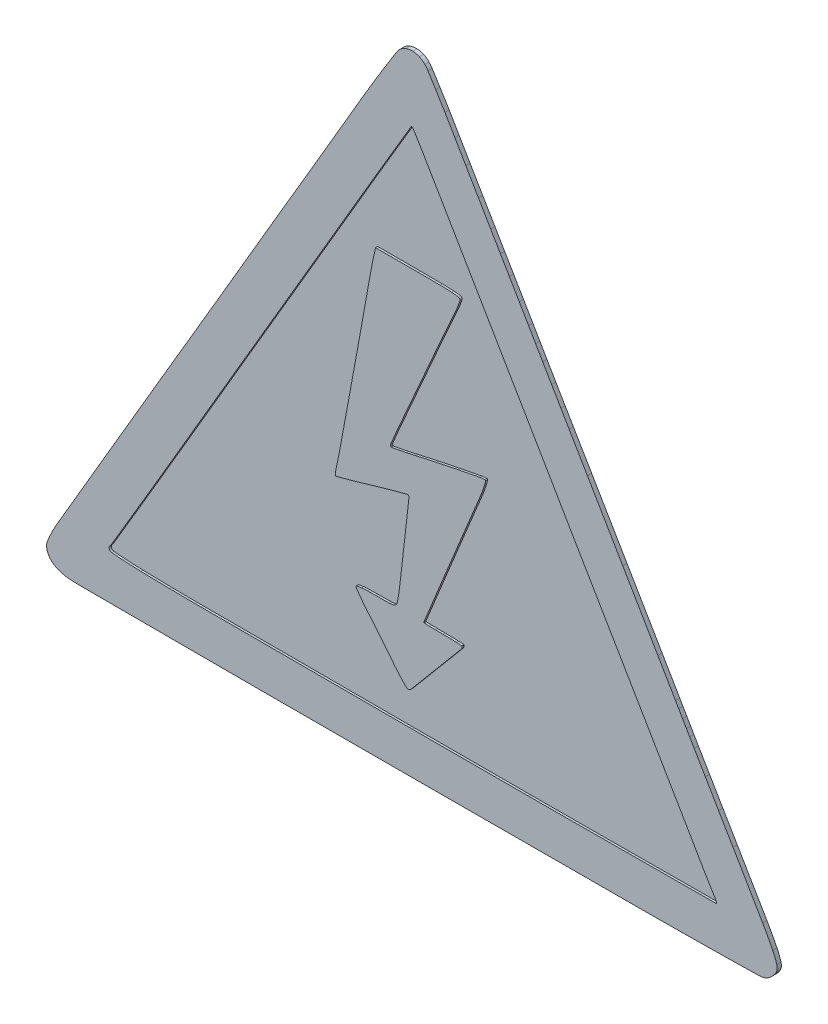
from build123d import *

# Parameters (mm, degrees)
SALIENTE_EXTRUIR1_DEPTH   = 2
SALIENTE_EXTRUIR1_2_DEPTH = 2
SALIENTE_EXTRUIR2_DEPTH   = 1


with BuildPart() as part:
    # Model → Saliente-Extruir1 (new body)
    with BuildSketch(Plane.XY):
        with BuildLine():
            ThreePointArc((416.430197, 527.849842), (412.923750156, 521.934018563), (409.448184, 516))
            Line((409.448184, 516), (401.939084, 503.113004))
            Line((401.939084, 503.113004), (394.060376, 489.6125))
            Line((394.060376, 489.6125), (386.92117, 477.396705))
            Line((386.92117, 477.396705), (382, 469))
            Line((382, 469), (377.075849, 460.603484))
            Line((377.075849, 460.603484), (369.926018, 448.3875))
            Line((369.926018, 448.3875), (362.032334, 434.886999))
            Line((362.032334, 434.886999), (354.505499, 422))
            Line((354.505499, 422), (347.08452, 409.296129))
            Line((347.08452, 409.296129), (339.509516, 396.346875))
            Line((339.509516, 396.346875), (332.792163, 384.879413))
            Line((332.792163, 384.879413), (328.456227, 377.5))
            Line((328.456227, 377.5), (323.875911, 369.702996))
            Line((323.875911, 369.702996), (315.943002, 356.15625))
            Line((315.943002, 356.15625), (306.760551, 340.457838))
            Line((306.760551, 340.457838), (297.43696, 324.5))
            Line((297.43696, 324.5), (288.290074, 308.838862))
            Line((288.290074, 308.838862), (279.640018, 294.034475))
            Line((279.640018, 294.034475), (272.335658, 281.538426))
            Line((272.335658, 281.538426), (268.831652, 275.553532))
            ThreePointArc((268.831652, 275.553532), (267.643279765, 273.477287903), (266.498497, 271.376695))
            ThreePointArc((266.498497, 271.376695), (265.537732428, 269.500739616), (264.634538, 267.596398))
            ThreePointArc((264.634538, 267.596398), (263.952827427, 266.03979721), (263.317632, 264.463643))
            ThreePointArc((263.317632, 264.463643), (263.080084515, 263.62552237), (263, 262.758077))
            ThreePointArc((263, 262.758077), (263.178190186, 261.213999553), (263.703395, 259.751096))
            ThreePointArc((263.703395, 259.751096), (264.557685736, 258.408881349), (265.678065, 257.279234))
            ThreePointArc((265.678065, 257.279234), (267.19880015, 256.251542805), (268.875977, 255.505981))
            ThreePointArc((268.875977, 255.505981), (270.970220708, 254.910091879), (273.115825, 254.539521))
            ThreePointArc((273.115825, 254.539521), (275.235339101, 254.350221442), (277.362243, 254.283482))
            Line((277.362243, 254.283482), (324.225128, 254.17688))
            ThreePointArc((324.225128, 254.17688), (350.823582643, 254.138627215), (377.422064, 254.132133))
            Line((377.422064, 254.132133), (439.544184, 254.200801))
            Line((439.544184, 254.200801), (540.663889, 254.427492))
            ThreePointArc((540.663889, 254.427492), (559.288658378, 254.523919526), (577.912693, 254.715406))
            ThreePointArc((577.912693, 254.715406), (588.698628999, 254.881591571), (599.483567, 255.103279))
            ThreePointArc((599.483567, 255.103279), (601.495703142, 255.432876077), (603.339721, 256.30289))
            ThreePointArc((603.339721, 256.30289), (603.924221205, 256.717807899), (604.476223, 257.175073))
            ThreePointArc((604.476223, 257.175073), (605.061059424, 257.725991376), (605.615898, 258.30711))
            ThreePointArc((605.615898, 258.30711), (606.120687471, 258.895725518), (606.593106, 259.510625))
            ThreePointArc((606.593106, 259.510625), (606.93615701, 260.036477724), (607.224806, 260.59405))
            ThreePointArc((607.224806, 260.59405), (607.62336217, 262.155539029), (607.45392, 263.758157))
            ThreePointArc((607.45392, 263.758157), (606.607518538, 266.24276379), (605.539456, 268.640452))
            ThreePointArc((605.539456, 268.640452), (603.233329183, 273.070112196), (600.790475, 277.425864))
            ThreePointArc((600.790475, 277.425864), (593.807815162, 289.403731538), (586.798486, 301.366012))
            Line((586.798486, 301.366012), (580.00006, 312.943251))
            Line((580.00006, 312.943251), (573.729503, 323.630954))
            Line((573.729503, 323.630954), (568.474019, 332.596389))
            Line((568.474019, 332.596389), (566.341853, 336.25))
            Line((566.341853, 336.25), (564.820585, 338.867571))
            Line((564.820585, 338.867571), (563.000175, 342))
            Line((563.000175, 342), (561.179825, 345.13243))
            Line((561.179825, 345.13243), (559.658743, 347.75))
            Line((559.658743, 347.75), (551.354162, 361.999301))
            Line((551.354162, 361.999301), (534.742248, 390.405982))
            Line((534.742248, 390.405982), (518.121933, 418.801272))
            Line((518.121933, 418.801272), (509.4906, 433.5))
            Line((509.4906, 433.5), (505.601969, 440.11849))
            Line((505.601969, 440.11849), (501.211805, 447.61875))
            Line((501.211805, 447.61875), (497.000478, 454.835745))
            Line((497.000478, 454.835745), (493.710846, 460.5))
            Line((493.710846, 460.5), (490.364183, 466.261325))
            Line((490.364183, 466.261325), (485.950822, 473.821875))
            Line((485.950822, 473.821875), (481.276478, 481.805429))
            Line((481.276478, 481.805429), (477.049172, 489))
            Line((477.049172, 489), (472.488256, 496.76225))
            Line((472.488256, 496.76225), (466.729954, 506.592119))
            Line((466.729954, 506.592119), (460.777387, 516.774124))
            Line((460.777387, 516.774124), (455.561736, 525.717853))
            ThreePointArc((455.561736, 525.717853), (453.233314345, 529.689247458), (450.881241, 533.64668))
            ThreePointArc((450.881241, 533.64668), (448.733927828, 537.202372853), (446.557842, 540.74053))
            ThreePointArc((446.557842, 540.74053), (444.713362388, 543.694505499), (442.85287, 546.638422))
            ThreePointArc((442.85287, 546.638422), (442.188981271, 547.585091725), (441.442212, 548.467853))
            ThreePointArc((441.442212, 548.467853), (440.237689815, 549.527837311), (438.843834, 550.322574))
            ThreePointArc((438.843834, 550.322574), (437.301331377, 550.830894994), (435.689316, 551.02866))
            ThreePointArc((435.689316, 551.02866), (434.048835522, 550.909331853), (432.461745, 550.477407))
            ThreePointArc((432.461745, 550.477407), (430.977837148, 549.747257215), (429.658527, 548.75))
            ThreePointArc((429.658527, 548.75), (428.83724314, 547.888500965), (428.138478, 546.924958))
            ThreePointArc((428.138478, 546.924958), (425.415994455, 542.568352529), (422.709876, 538.201563))
            ThreePointArc((422.709876, 538.201563), (419.55030612, 533.037671568), (416.430197, 527.849842))
        make_face()
        with BuildLine():
            ThreePointArc((438.198212, 515.837765), (438.975290904, 514.546421242), (439.743869, 513.25))
            Line((439.743869, 513.25), (448.211646, 498.812694))
            Line((448.211646, 498.812694), (474.061677, 454.588307))
            Line((474.061677, 454.588307), (501.778861, 407.157611))
            ThreePointArc((501.778861, 407.157611), (503.275383054, 404.582380815), (504.759532, 402))
            ThreePointArc((504.759532, 402), (505.503340462, 400.706072656), (506.253586, 399.415867))
            Line((506.253586, 399.415867), (514.178055, 385.86875))
            Line((514.178055, 385.86875), (523.424765, 370.072826))
            Line((523.424765, 370.072826), (534.013553, 352))
            Line((534.013553, 352), (544.998385, 333.243829))
            Line((544.998385, 333.243829), (555.46692, 315.340625))
            Line((555.46692, 315.340625), (564.329822, 300.158748))
            Line((564.329822, 300.158748), (568.775213, 292.5))
            Line((568.775213, 292.5), (571.749978, 287.376922))
            Line((571.749978, 287.376922), (574.476773, 282.739326))
            Line((574.476773, 282.739326), (576.784025, 278.862394))
            ThreePointArc((576.784025, 278.862394), (577.202127118, 278.188075149), (577.641613, 277.527494))
            ThreePointArc((577.641613, 277.527494), (577.908440496, 277.125760299), (578.161632, 276.715296))
            ThreePointArc((578.161632, 276.715296), (578.389105211, 276.314894696), (578.600974, 275.906022))
            ThreePointArc((578.600974, 275.906022), (578.766276036, 275.554953185), (578.918305, 275.197936))
            ThreePointArc((578.918305, 275.197936), (578.979386902, 274.991646694), (579, 274.777494))
            ThreePointArc((579, 274.777494), (578.90689246, 274.551829861), (578.681747, 274.457475))
            Line((578.681747, 274.457475), (536.846875, 274.228389))
            ThreePointArc((536.846875, 274.228389), (513.686106062, 274.122512267), (490.525191, 274.05587))
            Line((490.525191, 274.05587), (435.5, 274))
            Line((435.5, 274), (336.363765, 274.053289))
            ThreePointArc((336.363765, 274.053289), (321.94037209, 274.154672757), (307.519209, 274.427797))
            ThreePointArc((307.519209, 274.427797), (300.635073768, 274.718936011), (293.765211, 275.249092))
            ThreePointArc((293.765211, 275.249092), (292.615179288, 276.130562927), (292.906319, 277.55))
            ThreePointArc((292.906319, 277.55), (293.246064807, 277.949544722), (293.537995, 278.385251))
            Line((293.537995, 278.385251), (303.751815, 295.699063))
            Line((303.751815, 295.699063), (315.169722, 315.120233))
            Line((315.169722, 315.120233), (328.554452, 338))
            Line((328.554452, 338), (342.204744, 361.374872))
            Line((342.204744, 361.374872), (354.470266, 382.371875))
            Line((354.470266, 382.371875), (364.789156, 400.031274))
            Line((364.789156, 400.031274), (367.992123, 405.5))
            Line((367.992123, 405.5), (370.719672, 410.154068))
            Line((370.719672, 410.154068), (375.941876, 419.08125))
            Line((375.941876, 419.08125), (382.077848, 429.576308))
            Line((382.077848, 429.576308), (388.460929, 440.5))
            Line((388.460929, 440.5), (415.414724, 486.612303))
            ThreePointArc((415.414724, 486.612303), (421.308011551, 496.661873977), (427.224538, 506.697781))
            Line((427.224538, 506.697781), (434.914392, 519.692959))
            ThreePointArc((434.914392, 519.692959), (435.143099204, 519.917851453), (435.453156, 520))
            ThreePointArc((435.453156, 520), (435.561882693, 519.972256917), (435.644024, 519.895811))
            Line((435.644024, 519.895811), (436.845104, 518.017187))
            ThreePointArc((436.845104, 518.017187), (437.527442186, 516.931067149), (438.198212, 515.837765))
        make_face(mode=Mode.SUBTRACT)
    extrude(amount=SALIENTE_EXTRUIR1_DEPTH)



with BuildPart() as body_2:
    # Model → Saliente-Extruir1 2 (new body)
    with BuildSketch(Plane.XY):
        with BuildLine():
            ThreePointArc((417.111387, 457.083778), (416.835348844, 455.763698724), (416.572853, 454.44086))
            Line((416.572853, 454.44086), (415.761166, 450.176778))
            Line((415.761166, 450.176778), (414.862085, 445.311607))
            Line((414.862085, 445.311607), (413.995454, 440.474214))
            ThreePointArc((413.995454, 440.474214), (412.285646525, 430.852649106), (410.549694, 421.235767))
            Line((410.549694, 421.235767), (405.886688, 395.775266))
            Line((405.886688, 395.775266), (401.130965, 370.055395))
            ThreePointArc((401.130965, 370.055395), (400.557010462, 367.112704391), (399.928549, 364.181171))
            ThreePointArc((399.928549, 364.181171), (399.742691095, 363.318344407), (399.571179, 362.452552))
            ThreePointArc((399.571179, 362.452552), (399.438165924, 361.698468928), (399.324307, 360.941257))
            ThreePointArc((399.324307, 360.941257), (399.242512567, 360.312491814), (399.169798, 359.682612))
            ThreePointArc((399.169798, 359.682612), (399.187777746, 359.527719113), (399.270887, 359.39578))
            ThreePointArc((399.270887, 359.39578), (399.41835356, 359.310716487), (399.588595, 359.310915))
            Line((399.588595, 359.310915), (404.451679, 360.62853))
            ThreePointArc((404.451679, 360.62853), (407.20758003, 361.389772731), (409.95781, 362.171256))
            ThreePointArc((409.95781, 362.171256), (413.196946145, 363.112442215), (416.431818, 364.068182))
            ThreePointArc((416.431818, 364.068182), (419.66959183, 365.022416598), (422.912885, 365.95772))
            ThreePointArc((422.912885, 365.95772), (425.673701236, 366.731009456), (428.441733, 367.478059))
            Line((428.441733, 367.478059), (433.285902, 368.750144))
            ThreePointArc((433.285902, 368.750144), (433.504763642, 368.748987013), (433.694113, 368.639221))
            ThreePointArc((433.694113, 368.639221), (433.908825356, 368.297533737), (433.954049, 367.896527))
            Line((433.954049, 367.896527), (431.599928, 347.041173))
            ThreePointArc((431.599928, 347.041173), (430.515929619, 337.56921503), (429.409107, 328.099897))
            ThreePointArc((429.409107, 328.099897), (428.993203258, 325.163750577), (428.441851, 322.25))
            ThreePointArc((428.441851, 322.25), (428.205515624, 321.579572311), (427.80624, 320.991434))
            ThreePointArc((427.80624, 320.991434), (427.292626782, 320.56773188), (426.673813, 320.321985))
            ThreePointArc((426.673813, 320.321985), (425.550321029, 320.128134583), (424.412884, 320.050358))
            ThreePointArc((424.412884, 320.050358), (421.447022885, 320.012588466), (418.480948, 320))
            ThreePointArc((418.480948, 320), (416.541660986, 319.983478827), (414.602937, 319.933917))
            ThreePointArc((414.602937, 319.933917), (413.100090964, 319.855634158), (411.601027, 319.723416))
            ThreePointArc((411.601027, 319.723416), (410.481029693, 319.588340741), (409.365281, 319.421775))
            ThreePointArc((409.365281, 319.421775), (409.103649961, 319.273912156), (409, 318.991829))
            ThreePointArc((409, 318.991829), (409.051526266, 318.65534351), (409.201383, 318.349696))
            ThreePointArc((409.201383, 318.349696), (409.93927043, 317.301780383), (410.689062, 316.262349))
            ThreePointArc((410.689062, 316.262349), (411.605879437, 315.032215747), (412.546806, 313.820424))
            ThreePointArc((412.546806, 313.820424), (413.639298939, 312.460652049), (414.75, 311.115712))
            ThreePointArc((414.75, 311.115712), (416.070731708, 309.53068975), (417.384047, 307.939517))
            Line((417.384047, 307.939517), (420.573438, 304.036412))
            Line((420.573438, 304.036412), (423.785403, 300.064057))
            ThreePointArc((423.785403, 300.064057), (425.146226073, 298.364997965), (426.5, 296.660317))
            ThreePointArc((426.5, 296.660317), (427.676934656, 295.202256541), (428.882841, 293.768065))
            ThreePointArc((428.882841, 293.768065), (429.961156965, 292.549509992), (431.076143, 291.364416))
            ThreePointArc((431.076143, 291.364416), (432.012158042, 290.418217889), (432.96655, 289.490559))
            ThreePointArc((432.96655, 289.490559), (433.285129599, 289.305926619), (433.652828, 289.286434))
            ThreePointArc((433.652828, 289.286434), (434.362272596, 289.549372897), (434.941715, 290.035886))
            Line((434.941715, 290.035886), (446.733973, 304.052849))
            Line((446.733973, 304.052849), (458.497567, 318.103192))
            ThreePointArc((458.497567, 318.103192), (458.870512504, 318.751695959), (459, 319.488499))
            ThreePointArc((459, 319.488499), (458.944335715, 319.629755877), (458.807271, 319.695065))
            ThreePointArc((458.807271, 319.695065), (457.582002345, 319.776238171), (456.35625, 319.849747))
            ThreePointArc((456.35625, 319.849747), (454.90410457, 319.919367682), (453.450953, 319.96323))
            ThreePointArc((453.450953, 319.96323), (451.725574437, 319.990806613), (450, 320))
            ThreePointArc((450, 320), (448.274457758, 320.004979168), (446.548973, 320.019918))
            ThreePointArc((446.548973, 320.019918), (445.096213607, 320.043677939), (443.64375, 320.081412))
            Line((443.64375, 320.081412), (441.109133, 320.164183))
            ThreePointArc((441.109133, 320.164183), (441.031739695, 320.198612331), (441, 320.277147))
            ThreePointArc((441, 320.277147), (441.026498669, 320.548596205), (441.104994, 320.809796))
            Line((441.104994, 320.809796), (450.391025, 343.446101))
            Line((450.391025, 343.446101), (459.207792, 364.866731))
            ThreePointArc((459.207792, 364.866731), (463.014130712, 374.061745131), (466.836757, 383.25))
            ThreePointArc((466.836757, 383.25), (467.663199658, 385.276995777), (468.457123, 387.316948))
            ThreePointArc((468.457123, 387.316948), (469.001831804, 388.838563951), (469.487142, 390.380153))
            ThreePointArc((469.487142, 390.380153), (469.785615631, 391.473240707), (470.04225, 392.576901))
            ThreePointArc((470.04225, 392.576901), (469.971841688, 392.870161289), (469.699627, 393))
            ThreePointArc((469.699627, 393), (468.482171807, 392.941965518), (467.275757, 392.76839))
            ThreePointArc((467.275757, 392.76839), (462.342530561, 391.809427033), (457.412137, 390.836004))
            ThreePointArc((457.412137, 390.836004), (452.152950421, 389.77217657), (446.900669, 388.674765))
            ThreePointArc((446.900669, 388.674765), (442.00858919, 387.616156144), (437.124992, 386.51908))
            ThreePointArc((437.124992, 386.51908), (434.93249823, 386.026049909), (432.736398, 385.549341))
            ThreePointArc((432.736398, 385.549341), (430.859288766, 385.160879594), (428.977676, 384.794854))
            Line((428.977676, 384.794854), (425.719085, 384.192449))
            ThreePointArc((425.719085, 384.192449), (425.527277279, 384.204311016), (425.362863, 384.303804))
            ThreePointArc((425.362863, 384.303804), (425.199994844, 384.605331082), (425.22911, 384.946794))
            ThreePointArc((425.22911, 384.946794), (425.930311445, 386.700856933), (426.649308, 388.447701))
            ThreePointArc((426.649308, 388.447701), (427.942106016, 391.504602355), (429.262686, 394.549605))
            Line((429.262686, 394.549605), (436.718769, 411.5))
            Line((436.718769, 411.5), (439.84227, 418.59528))
            Line((439.84227, 418.59528), (443.032754, 425.85625))
            Line((443.032754, 425.85625), (445.86206, 432.306843))
            Line((445.86206, 432.306843), (447.693915, 436.5))
            Line((447.693915, 436.5), (449.275419, 440.096855))
            Line((449.275419, 440.096855), (451.156568, 444.310176))
            Line((451.156568, 444.310176), (453.031807, 448.461681))
            Line((453.031807, 448.461681), (454.589033, 451.853792))
            ThreePointArc((454.589033, 451.853792), (455.252031662, 453.308629626), (455.895471, 454.772223))
            ThreePointArc((455.895471, 454.772223), (456.458763622, 456.10995016), (456.998028, 457.457543))
            ThreePointArc((456.998028, 457.457543), (457.429662639, 458.586887112), (457.846269, 459.721861))
            ThreePointArc((457.846269, 459.721861), (457.96127978, 460.156177327), (458, 460.603792))
            ThreePointArc((458, 460.603792), (457.816431466, 461.10298925), (457.35319, 461.364337))
            ThreePointArc((457.35319, 461.364337), (455.772651743, 461.58458086), (454.18371, 461.732475))
            ThreePointArc((454.18371, 461.732475), (451.467689654, 461.881700575), (448.748402, 461.948853))
            ThreePointArc((448.748402, 461.948853), (443.415694325, 461.98721448), (438.082864, 462))
            Line((438.082864, 462), (418.165728, 462))
            Line((418.165728, 462), (417.111387, 457.083778))
        make_face()
    extrude(amount=SALIENTE_EXTRUIR1_2_DEPTH)


with BuildPart() as part_1:
    add(part.part)

    add(body_2.part)  # Saliente-Extruir2 merges body 2
    # Model<3> → Saliente-Extruir2 (add)
    with BuildSketch(Plane.XY):
        with BuildLine():
            Line((448.211646, 498.812694), (439.743869, 513.25))
            ThreePointArc((439.743869, 513.25), (438.975290904, 514.546421242), (438.198212, 515.837765))
            ThreePointArc((438.198212, 515.837765), (437.527442186, 516.931067149), (436.845104, 518.017187))
            Line((436.845104, 518.017187), (435.644024, 519.895811))
            ThreePointArc((435.644024, 519.895811), (435.561882693, 519.972256917), (435.453156, 520))
            ThreePointArc((435.453156, 520), (435.143099204, 519.917851453), (434.914392, 519.692959))
            Line((434.914392, 519.692959), (427.224538, 506.697781))
            ThreePointArc((427.224538, 506.697781), (421.308011551, 496.661873977), (415.414724, 486.612303))
            Line((415.414724, 486.612303), (388.460929, 440.5))
            Line((388.460929, 440.5), (382.077848, 429.576308))
            Line((382.077848, 429.576308), (375.941876, 419.08125))
            Line((375.941876, 419.08125), (370.719672, 410.154068))
            Line((370.719672, 410.154068), (367.992123, 405.5))
            Line((367.992123, 405.5), (364.789156, 400.031274))
            Line((364.789156, 400.031274), (354.470266, 382.371875))
            Line((354.470266, 382.371875), (342.204744, 361.374872))
            Line((342.204744, 361.374872), (328.554452, 338))
            Line((328.554452, 338), (315.169722, 315.120233))
            Line((315.169722, 315.120233), (303.751815, 295.699063))
            Line((303.751815, 295.699063), (293.537995, 278.385251))
            ThreePointArc((293.537995, 278.385251), (293.246064807, 277.949544722), (292.906319, 277.55))
            ThreePointArc((292.906319, 277.55), (292.615179288, 276.130562927), (293.765211, 275.249092))
            ThreePointArc((293.765211, 275.249092), (300.635073768, 274.718936011), (307.519209, 274.427797))
            ThreePointArc((307.519209, 274.427797), (321.94037209, 274.154672757), (336.363765, 274.053289))
            Line((336.363765, 274.053289), (435.5, 274))
            Line((435.5, 274), (490.525191, 274.05587))
            ThreePointArc((490.525191, 274.05587), (513.686106062, 274.122512267), (536.846875, 274.228389))
            Line((536.846875, 274.228389), (578.681747, 274.457475))
            ThreePointArc((578.681747, 274.457475), (578.90689246, 274.551829861), (579, 274.777494))
            ThreePointArc((579, 274.777494), (578.979386902, 274.991646694), (578.918305, 275.197936))
            ThreePointArc((578.918305, 275.197936), (578.766276036, 275.554953185), (578.600974, 275.906022))
            ThreePointArc((578.600974, 275.906022), (578.389105211, 276.314894696), (578.161632, 276.715296))
            ThreePointArc((578.161632, 276.715296), (577.908440496, 277.125760299), (577.641613, 277.527494))
            ThreePointArc((577.641613, 277.527494), (577.202127118, 278.188075149), (576.784025, 278.862394))
            Line((576.784025, 278.862394), (574.476773, 282.739326))
            Line((574.476773, 282.739326), (571.749978, 287.376922))
            Line((571.749978, 287.376922), (568.775213, 292.5))
            Line((568.775213, 292.5), (564.329822, 300.158748))
            Line((564.329822, 300.158748), (555.46692, 315.340625))
            Line((555.46692, 315.340625), (544.998385, 333.243829))
            Line((544.998385, 333.243829), (534.013553, 352))
            Line((534.013553, 352), (523.424765, 370.072826))
            Line((523.424765, 370.072826), (514.178055, 385.86875))
            Line((514.178055, 385.86875), (506.253586, 399.415867))
            ThreePointArc((506.253586, 399.415867), (505.503340462, 400.706072656), (504.759532, 402))
            ThreePointArc((504.759532, 402), (503.275383054, 404.582380815), (501.778861, 407.157611))
            Line((501.778861, 407.157611), (474.061677, 454.588307))
            Line((474.061677, 454.588307), (448.211646, 498.812694))
        make_face()
        with BuildLine():
            Line((415.761166, 450.176778), (416.572853, 454.44086))
            ThreePointArc((416.572853, 454.44086), (416.835348844, 455.763698724), (417.111387, 457.083778))
            Line((417.111387, 457.083778), (418.165728, 462))
            Line((418.165728, 462), (438.082864, 462))
            ThreePointArc((438.082864, 462), (443.415694325, 461.98721448), (448.748402, 461.948853))
            ThreePointArc((448.748402, 461.948853), (451.467689654, 461.881700575), (454.18371, 461.732475))
            ThreePointArc((454.18371, 461.732475), (455.772651743, 461.58458086), (457.35319, 461.364337))
            ThreePointArc((457.35319, 461.364337), (457.816431466, 461.10298925), (458, 460.603792))
            ThreePointArc((458, 460.603792), (457.96127978, 460.156177327), (457.846269, 459.721861))
            ThreePointArc((457.846269, 459.721861), (457.429662639, 458.586887112), (456.998028, 457.457543))
            ThreePointArc((456.998028, 457.457543), (456.458763622, 456.10995016), (455.895471, 454.772223))
            ThreePointArc((455.895471, 454.772223), (455.252031662, 453.308629626), (454.589033, 451.853792))
            Line((454.589033, 451.853792), (453.031807, 448.461681))
            Line((453.031807, 448.461681), (451.156568, 444.310176))
            Line((451.156568, 444.310176), (449.275419, 440.096855))
            Line((449.275419, 440.096855), (447.693915, 436.5))
            Line((447.693915, 436.5), (445.86206, 432.306843))
            Line((445.86206, 432.306843), (443.032754, 425.85625))
            Line((443.032754, 425.85625), (439.84227, 418.59528))
            Line((439.84227, 418.59528), (436.718769, 411.5))
            Line((436.718769, 411.5), (429.262686, 394.549605))
            ThreePointArc((429.262686, 394.549605), (427.942106016, 391.504602355), (426.649308, 388.447701))
            ThreePointArc((426.649308, 388.447701), (425.930311445, 386.700856933), (425.22911, 384.946794))
            ThreePointArc((425.22911, 384.946794), (425.199994844, 384.605331082), (425.362863, 384.303804))
            ThreePointArc((425.362863, 384.303804), (425.527277279, 384.204311016), (425.719085, 384.192449))
            Line((425.719085, 384.192449), (428.977676, 384.794854))
            ThreePointArc((428.977676, 384.794854), (430.859288766, 385.160879594), (432.736398, 385.549341))
            ThreePointArc((432.736398, 385.549341), (434.93249823, 386.026049909), (437.124992, 386.51908))
            ThreePointArc((437.124992, 386.51908), (442.00858919, 387.616156144), (446.900669, 388.674765))
            ThreePointArc((446.900669, 388.674765), (452.152950421, 389.77217657), (457.412137, 390.836004))
            ThreePointArc((457.412137, 390.836004), (462.342530561, 391.809427033), (467.275757, 392.76839))
            ThreePointArc((467.275757, 392.76839), (468.482171807, 392.941965518), (469.699627, 393))
            ThreePointArc((469.699627, 393), (469.971841688, 392.870161289), (470.04225, 392.576901))
            ThreePointArc((470.04225, 392.576901), (469.785615631, 391.473240707), (469.487142, 390.380153))
            ThreePointArc((469.487142, 390.380153), (469.001831804, 388.838563951), (468.457123, 387.316948))
            ThreePointArc((468.457123, 387.316948), (467.663199658, 385.276995777), (466.836757, 383.25))
            ThreePointArc((466.836757, 383.25), (463.014130712, 374.061745131), (459.207792, 364.866731))
            Line((459.207792, 364.866731), (450.391025, 343.446101))
            Line((450.391025, 343.446101), (441.104994, 320.809796))
            ThreePointArc((441.104994, 320.809796), (441.026498669, 320.548596205), (441, 320.277147))
            ThreePointArc((441, 320.277147), (441.031739695, 320.198612331), (441.109133, 320.164183))
            Line((441.109133, 320.164183), (443.64375, 320.081412))
            ThreePointArc((443.64375, 320.081412), (445.096213607, 320.043677939), (446.548973, 320.019918))
            ThreePointArc((446.548973, 320.019918), (448.274457758, 320.004979168), (450, 320))
            ThreePointArc((450, 320), (451.725574437, 319.990806613), (453.450953, 319.96323))
            ThreePointArc((453.450953, 319.96323), (454.90410457, 319.919367682), (456.35625, 319.849747))
            ThreePointArc((456.35625, 319.849747), (457.582002345, 319.776238171), (458.807271, 319.695065))
            ThreePointArc((458.807271, 319.695065), (458.944335715, 319.629755877), (459, 319.488499))
            ThreePointArc((459, 319.488499), (458.870512504, 318.751695959), (458.497567, 318.103192))
            Line((458.497567, 318.103192), (446.733973, 304.052849))
            Line((446.733973, 304.052849), (434.941715, 290.035886))
            ThreePointArc((434.941715, 290.035886), (434.362272596, 289.549372897), (433.652828, 289.286434))
            ThreePointArc((433.652828, 289.286434), (433.285129599, 289.305926619), (432.96655, 289.490559))
            ThreePointArc((432.96655, 289.490559), (432.012158042, 290.418217889), (431.076143, 291.364416))
            ThreePointArc((431.076143, 291.364416), (429.961156965, 292.549509992), (428.882841, 293.768065))
            ThreePointArc((428.882841, 293.768065), (427.676934656, 295.202256541), (426.5, 296.660317))
            ThreePointArc((426.5, 296.660317), (425.146226073, 298.364997965), (423.785403, 300.064057))
            Line((423.785403, 300.064057), (420.573438, 304.036412))
            Line((420.573438, 304.036412), (417.384047, 307.939517))
            ThreePointArc((417.384047, 307.939517), (416.070731708, 309.53068975), (414.75, 311.115712))
            ThreePointArc((414.75, 311.115712), (413.639298939, 312.460652049), (412.546806, 313.820424))
            ThreePointArc((412.546806, 313.820424), (411.605879437, 315.032215747), (410.689062, 316.262349))
            ThreePointArc((410.689062, 316.262349), (409.93927043, 317.301780383), (409.201383, 318.349696))
            ThreePointArc((409.201383, 318.349696), (409.051526266, 318.65534351), (409, 318.991829))
            ThreePointArc((409, 318.991829), (409.103649961, 319.273912156), (409.365281, 319.421775))
            ThreePointArc((409.365281, 319.421775), (410.481029693, 319.588340741), (411.601027, 319.723416))
            ThreePointArc((411.601027, 319.723416), (413.100090964, 319.855634158), (414.602937, 319.933917))
            ThreePointArc((414.602937, 319.933917), (416.541660986, 319.983478827), (418.480948, 320))
            ThreePointArc((418.480948, 320), (421.447022885, 320.012588466), (424.412884, 320.050358))
            ThreePointArc((424.412884, 320.050358), (425.550321029, 320.128134583), (426.673813, 320.321985))
            ThreePointArc((426.673813, 320.321985), (427.292626782, 320.56773188), (427.80624, 320.991434))
            ThreePointArc((427.80624, 320.991434), (428.205515624, 321.579572311), (428.441851, 322.25))
            ThreePointArc((428.441851, 322.25), (428.993203258, 325.163750577), (429.409107, 328.099897))
            ThreePointArc((429.409107, 328.099897), (430.515929619, 337.56921503), (431.599928, 347.041173))
            Line((431.599928, 347.041173), (433.954049, 367.896527))
            ThreePointArc((433.954049, 367.896527), (433.908825356, 368.297533737), (433.694113, 368.639221))
            ThreePointArc((433.694113, 368.639221), (433.504763642, 368.748987013), (433.285902, 368.750144))
            Line((433.285902, 368.750144), (428.441733, 367.478059))
            ThreePointArc((428.441733, 367.478059), (425.673701236, 366.731009456), (422.912885, 365.95772))
            ThreePointArc((422.912885, 365.95772), (419.66959183, 365.022416598), (416.431818, 364.068182))
            ThreePointArc((416.431818, 364.068182), (413.196946145, 363.112442215), (409.95781, 362.171256))
            ThreePointArc((409.95781, 362.171256), (407.20758003, 361.389772731), (404.451679, 360.62853))
            Line((404.451679, 360.62853), (399.588595, 359.310915))
            ThreePointArc((399.588595, 359.310915), (399.41835356, 359.310716487), (399.270887, 359.39578))
            ThreePointArc((399.270887, 359.39578), (399.187777746, 359.527719113), (399.169798, 359.682612))
            ThreePointArc((399.169798, 359.682612), (399.242512567, 360.312491814), (399.324307, 360.941257))
            ThreePointArc((399.324307, 360.941257), (399.438165924, 361.698468928), (399.571179, 362.452552))
            ThreePointArc((399.571179, 362.452552), (399.742691095, 363.318344407), (399.928549, 364.181171))
            ThreePointArc((399.928549, 364.181171), (400.557010462, 367.112704391), (401.130965, 370.055395))
            Line((401.130965, 370.055395), (405.886688, 395.775266))
            Line((405.886688, 395.775266), (410.549694, 421.235767))
            ThreePointArc((410.549694, 421.235767), (412.285646525, 430.852649106), (413.995454, 440.474214))
            Line((413.995454, 440.474214), (414.862085, 445.311607))
            Line((414.862085, 445.311607), (415.761166, 450.176778))
        make_face(mode=Mode.SUBTRACT)
    extrude(amount=SALIENTE_EXTRUIR2_DEPTH)


solid = part_1.part
